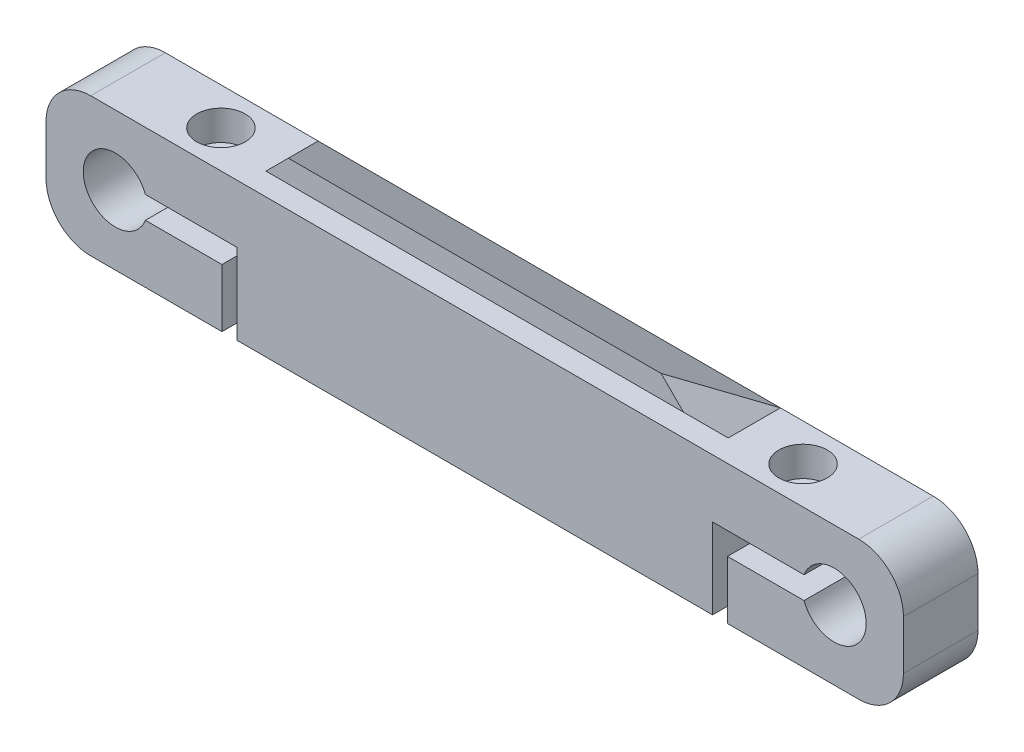
from build123d import *

# Parameters (mm, degrees)
SALIENTE_EXTRUIR1_DEPTH = 10
CROQUIS2_R              = 1.9
CORTAR_EXTRUIR1_DEPTH   = 25
CROQUIS5_R              = 3.25
CORTAR_EXTRUIR3_DEPTH   = 4
CORTAR_EXTRUIR4_DEPTH   = 4.25
SALIENTE_EXTRUIR2_DEPTH = 25
CHAFL_N2_SIZE           = 6
SALIENTE_EXTRUIR3_DEPTH = 5
CROQUIS9_R              = 1.9
CORTAR_EXTRUIR5_DEPTH   = 62.56630572
CORTAR_EXTRUIR6_DEPTH   = 2.75
SALIENTE_EXTRUIR4_DEPTH = 0.2


with BuildPart() as part:
    # Croquis1 → Saliente-Extruir1 (new body)
    with BuildSketch(Plane.XY):
        with BuildLine():
            Line((51.5, 9.3), (-51.5, 9.3))
            ThreePointArc((-51.5, 9.3), (-55.742640687, 7.542640687), (-57.5, 3.3))
            Line((-57.5, 3.3), (-57.5, -3.3))
            ThreePointArc((-57.5, -3.3), (-55.742640687, -7.542640687), (-51.5, -9.3))
            Line((-51.5, -9.3), (-33.9, -9.3))
            Line((-33.9, -9.3), (-33.9, -1.5))
            Line((-33.9, -1.5), (-44.170111664, -1.5))
            ThreePointArc((-44.170111664, -1.5), (-52.5, 0), (-44.170111664, 1.5))
            Line((-44.170111664, 1.5), (-31.9, 1.5))
            Line((-31.9, 1.5), (-31.9, -9.3))
            Line((-31.9, -9.3), (31.9, -9.3))
            Line((31.9, -9.3), (31.9, 1.5))
            Line((31.9, 1.5), (44.170111664, 1.5))
            ThreePointArc((44.170111664, 1.5), (48.962063041, 4.231933355), (52.5, 0))
            ThreePointArc((52.5, 0), (48.962063041, -4.231933355), (44.170111664, -1.5))
            Line((44.170111664, -1.5), (33.9, -1.5))
            Line((33.9, -1.5), (33.9, -9.3))
            Line((33.9, -9.3), (51.5, -9.3))
            ThreePointArc((51.5, -9.3), (55.742640687, -7.542640687), (57.5, -3.3))
            Line((57.5, -3.3), (57.5, 3.3))
            ThreePointArc((57.5, 3.3), (55.742640687, 7.542640687), (51.5, 9.3))
        make_face()
    extrude(amount=SALIENTE_EXTRUIR1_DEPTH)

    # Croquis2 → Cortar-Extruir1 (cut, symmetric)
    with BuildSketch(Plane.XZ.offset(-1.5)):
        with Locations(Location((-39.035111664, 5, 0), (0, 0, 180))):
            Circle(CROQUIS2_R)
        with Locations(Location((39.035111664, 5, 0), (0, 0, 180))):
            Circle(CROQUIS2_R)
    extrude(amount=CORTAR_EXTRUIR1_DEPTH, both=True, mode=Mode.SUBTRACT)

    # Croquis5 → Cortar-Extruir3 (cut)
    with BuildSketch(Plane(origin=(0, 9.3, 0), x_dir=(1, 0, 0), z_dir=(0, 1, 0))):
        with Locations(Location((-39.035111664, -5, 0), (0, 0, 270))):
            Circle(CROQUIS5_R)
        with Locations(Location((39.035111664, -5, 0), (0, 0, 270))):
            Circle(CROQUIS5_R)
    extrude(amount=-CORTAR_EXTRUIR3_DEPTH, mode=Mode.SUBTRACT)

    # Croquis6 → Cortar-Extruir4 (cut)
    with BuildSketch(Plane(origin=(0, -9.3, 0), x_dir=(-1, 0, 0), z_dir=(0, -1, 0))):
        Polygon((42.499213279, -5), (40.767162472, -2), (37.303060857, -2), (35.571010049, -5), (37.303060857, -8), (40.767162472, -8), align=None)
        Polygon((-42.499213279, -5), (-40.767162472, -8), (-37.303060857, -8), (-35.571010049, -5), (-37.303060857, -2), (-40.767162472, -2), align=None)
    extrude(amount=-CORTAR_EXTRUIR4_DEPTH, mode=Mode.SUBTRACT)

    # Croquis7 → Saliente-Extruir2 (add, symmetric)
    with BuildSketch(Plane.ZY):
        Polygon((0, 9.3), (10, 15.3), (10, 12.3), (7, 9.3), align=None)
    extrude(amount=SALIENTE_EXTRUIR2_DEPTH, both=True)

    # Chaflán2
    # the kernel refuses this chamfer: 6 mm, written as the material it adds along each edge
    with BuildSketch(Plane(origin=(-25, 9.3, 22.430097928), x_dir=(-0.9996219169112968, -0.02749587661058678, 0), z_dir=(0, 0, -1))) as chafl_n2_piece_1_section:
        Polygon((CHAFL_N2_SIZE * 0.999621916911, CHAFL_N2_SIZE * 0.0274958766106), (-CHAFL_N2_SIZE * 0.0274958766106, CHAFL_N2_SIZE * 0.999621916911), (0, 0), align=None)
    chafl_n2_piece_1 = extrude(amount=37.860195856, mode=Mode.PRIVATE)
    chafl_n2_piece_1 = split(chafl_n2_piece_1, bisect_by=Plane(origin=(-27.180769231, 9.432692308, 7.132692308), z_dir=(0, 0.7071067811865436, -0.7071067811865516)), keep=Keep.TOP, mode=Mode.PRIVATE)
    chafl_n2_piece_1 = split(chafl_n2_piece_1, bisect_by=Plane(origin=(-27.180769231, 10.938461538, 10), z_dir=(0, 0, -1)), keep=Keep.TOP, mode=Mode.PRIVATE)
    chafl_n2_piece_1 = split(chafl_n2_piece_1, bisect_by=Plane(origin=(-27.180769231, 12.216176471, 4.860294118), z_dir=(0, -0.8574929257125441, 0.5144957554275267)), keep=Keep.TOP, mode=Mode.PRIVATE)
    add(chafl_n2_piece_1)
    with BuildSketch(Plane(origin=(25, 9.3, 22.430097928), x_dir=(0.9996219169112969, -0.02749587661058621, 0), z_dir=(0, 0, -1))) as chafl_n2_piece_2_section:
        Polygon((CHAFL_N2_SIZE * 0.999621916911, -CHAFL_N2_SIZE * 0.0274958766106), (-CHAFL_N2_SIZE * 0.0274958766106, -CHAFL_N2_SIZE * 0.999621916911), (0, 0), align=None)
    chafl_n2_piece_2 = extrude(amount=37.860195856, mode=Mode.PRIVATE)
    chafl_n2_piece_2 = split(chafl_n2_piece_2, bisect_by=Plane(origin=(27.180769231, 9.432692308, 7.132692308), z_dir=(0, 0.7071067811865436, -0.7071067811865516)), keep=Keep.TOP, mode=Mode.PRIVATE)
    chafl_n2_piece_2 = split(chafl_n2_piece_2, bisect_by=Plane(origin=(27.180769231, 10.938461538, 10), z_dir=(0, 0, -1)), keep=Keep.TOP, mode=Mode.PRIVATE)
    chafl_n2_piece_2 = split(chafl_n2_piece_2, bisect_by=Plane(origin=(27.180769231, 12.216176471, 4.860294118), z_dir=(0, -0.8574929257125441, 0.5144957554275267)), keep=Keep.TOP, mode=Mode.PRIVATE)
    add(chafl_n2_piece_2)

    # Croquis8 → Saliente-Extruir3 (add)
    with BuildSketch(Plane.XZ.offset(9.3)):
        with BuildLine():
            Line((-31.9, 0), (-35.941451884, -7))
            ThreePointArc((-35.941451884, -7), (-35.941451884, -9), (-34.209401077, -10))
            Line((-34.209401077, -10), (34.209401077, -10))
            ThreePointArc((34.209401077, -10), (35.941451884, -9), (35.941451884, -7))
            Line((35.941451884, -7), (31.9, 0))
            Line((31.9, 0), (-31.9, 0))
        make_face()
    extrude(amount=-SALIENTE_EXTRUIR3_DEPTH)

    # Croquis9 → Cortar-Extruir5 (cut, through all)
    with BuildSketch(Plane(origin=(0, -4.3, 0), x_dir=(1, 0, 0), z_dir=(0, 1, 0))):
        with Locations(Location((0, 4.5, 0), (0, 0, 180))):
            Circle(CROQUIS9_R)
        with Locations(Location((-29.498076211, 4.5, 0), (0, 0, 180))):
            Circle(CROQUIS9_R)
        with Locations(Location((-14.748076211, 4.5, 0), (0, 0, 180))):
            Circle(CROQUIS9_R)
        with Locations(Location((14.748076211, 4.5, 0), (0, 0, 180))):
            Circle(CROQUIS9_R)
        with Locations(Location((29.498076211, 4.5, 0), (0, 0, 180))):
            Circle(CROQUIS9_R)
    extrude(amount=-CORTAR_EXTRUIR5_DEPTH, mode=Mode.SUBTRACT)

    # Croquis10 → Cortar-Extruir6 (cut)
    with BuildSketch(Plane.XZ.offset(9.3)):
        Polygon((3.406366588, -4.5), (1.703183294, -1.55), (-1.703183294, -1.55), (-3.406366588, -4.5), (-1.703183294, -7.45), (1.703183294, -7.45), align=None)
        Polygon((-11.341709623, -4.5), (-13.044892917, -1.55), (-16.451259505, -1.55), (-18.1544428, -4.5), (-16.451259505, -7.45), (-13.044892917, -7.45), align=None)
        Polygon((-26.091709623, -4.5), (-27.794892917, -1.55), (-31.201259505, -1.55), (-32.9044428, -4.5), (-31.201259505, -7.45), (-27.794892917, -7.45), align=None)
        Polygon((18.1544428, -4.5), (16.451259505, -1.55), (13.044892917, -1.55), (11.341709623, -4.5), (13.044892917, -7.45), (16.451259505, -7.45), align=None)
        Polygon((32.9044428, -4.5), (31.201259505, -1.55), (27.794892917, -1.55), (26.091709623, -4.5), (27.794892917, -7.45), (31.201259505, -7.45), align=None)
    extrude(amount=-CORTAR_EXTRUIR6_DEPTH, mode=Mode.SUBTRACT)

    # Croquis11 → Saliente-Extruir4 (add)
    with BuildSketch(Plane(origin=(0, -4.3, 0), x_dir=(1, 0, 0), z_dir=(0, 1, 0))):
        Polygon((-31.9, 0), (-32.766025404, 1.5), (32.766025404, 1.5), (31.9, 0), align=None)
    extrude(amount=SALIENTE_EXTRUIR4_DEPTH)


solid = part.part
